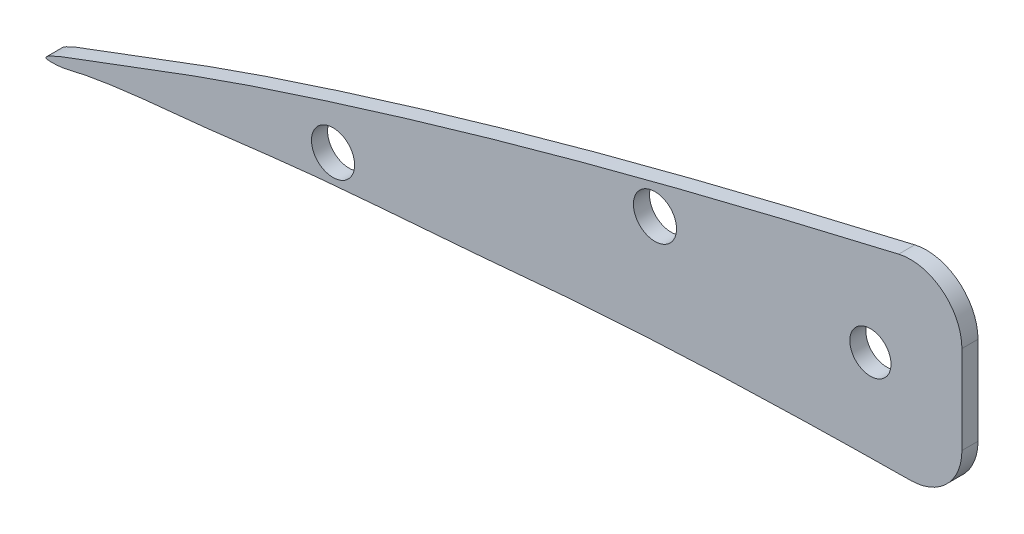
from build123d import *

# Parameters (mm, degrees)
BOSS_EXTRUDE1_DEPTH     = 226.06
CUT_EXTRUDE1_DEPTH      = 248.603669875
CUT_EXTRUDE1_DEPTH_BACK = 248.603669875
FILLET1_R               = 5.08
SKETCH4_W               = 41.117340127
SKETCH4_H               = 67.644656338
SKETCH4_W_2             = 211.282523513
SKETCH4_H_2             = 81.730555137
CUT_EXTRUDE5_DEPTH      = 246.233624371
SKETCH3_R               = 2.032
CUT_EXTRUDE2_DEPTH      = 220.17283623
SKETCH5_R               = 2.127
CUT_EXTRUDE6_DEPTH      = 96.073271919


with BuildPart() as part:
    # Sketch1 → Boss-Extrude1 (new body)
    with BuildSketch(Plane.XY):
        with BuildLine():
            Line((99.32639085, 18.404394796), (99.32639085, -2.986448862))
            add(Edge.make_bspline(
                [(5.047603806, -9.653713384), (9.482649657, -8.546128483), (16.988483729, -8.076906091), (30.336595099, -6.254410192), (41.946659702, -5.566037344), (65.865842143, -3.231342143), (83.974811725, -3.089086557), (99.32639085, -2.986448862)],
                knots=[0, 0, 0, 0, 0.144322392, 0.237947652, 0.42712275, 0.512831912, 1, 1, 1, 1], degree=3))
            add(Edge.make_bspline(
                [(5.047603806, -9.653713384), (1.304537033, -10.042523479), (11.503328192, -6.353494655), (19.723627138, -3.092777487), (52.915151131, 7.645918304), (77.889766355, 13.460013374), (99.32639085, 18.404394796)],
                knots=[0, 0, 0, 0, 0.059914523, 0.175786391, 0.369274689, 1, 1, 1, 1], degree=3))
        make_face()
    extrude(amount=BOSS_EXTRUDE1_DEPTH)

    # Sketch2 → Cut-Extrude1 (cut, two sides: drawn at the far end of the back side and taken through both)
    with BuildSketch(Plane(origin=(0, 0, 0), x_dir=(1, 0, 0), z_dir=(0, 1, 0)).offset(-CUT_EXTRUDE1_DEPTH_BACK)):
        Polygon((169.681502528, 0), (169.681502528, -226.06), (73.16439085, -226.06), (73.16439085, -197.485), (93.73839085, -197.485), (93.73839085, -28.575), (73.16439085, -28.575), (73.16439085, 0), align=None)
    extrude(amount=CUT_EXTRUDE1_DEPTH + CUT_EXTRUDE1_DEPTH_BACK, mode=Mode.SUBTRACT)

    # Fillet1
    fillet1_edges = [part.edges().sort_by_distance(p)[0] for p in [
        (73.16439085, -3.388889971, 14.2875),
        (73.16439085, 12.236004014, 14.2875),
        (93.73839085, -3.026654485, 113.03),
        (93.73839085, 17.113551214, 113.03),
        (73.16439085, -3.388889971, 211.7725),
        (73.16439085, 12.236004014, 211.7725),
    ]]
    fillet(fillet1_edges, radius=FILLET1_R)

    # Sketch4 → Cut-Extrude5 (cut, through all)
    with BuildSketch(Plane(origin=(0, 0, 0), x_dir=(0, 0, -1), z_dir=(1, 0, 0))):
        with Locations((-218.043670064, 8.278534275)):
            Rectangle(SKETCH4_W, SKETCH4_H)
        with Locations((-90.256238244, 1.235584875)):
            Rectangle(SKETCH4_W_2, SKETCH4_H_2)
    extrude(amount=CUT_EXTRUDE5_DEPTH, mode=Mode.SUBTRACT)

    # Sketch3 → Cut-Extrude2 (cut, through all)
    with BuildSketch(Plane.XY):
        with Locations((84.713563037, 5.874854857)):
            Circle(SKETCH3_R)
    extrude(amount=CUT_EXTRUDE2_DEPTH, mode=Mode.SUBTRACT)

    # Sketch5 → Cut-Extrude6 (cut, through all)
    with BuildSketch(Plane.XY.offset(197.485)):
        with Locations((31.717603806, -3.557713384)):
            Circle(SKETCH5_R)
        with Locations((63.467603806, 6.856286616)):
            Circle(SKETCH5_R)
    extrude(amount=-CUT_EXTRUDE6_DEPTH, mode=Mode.SUBTRACT)


solid = part.part
